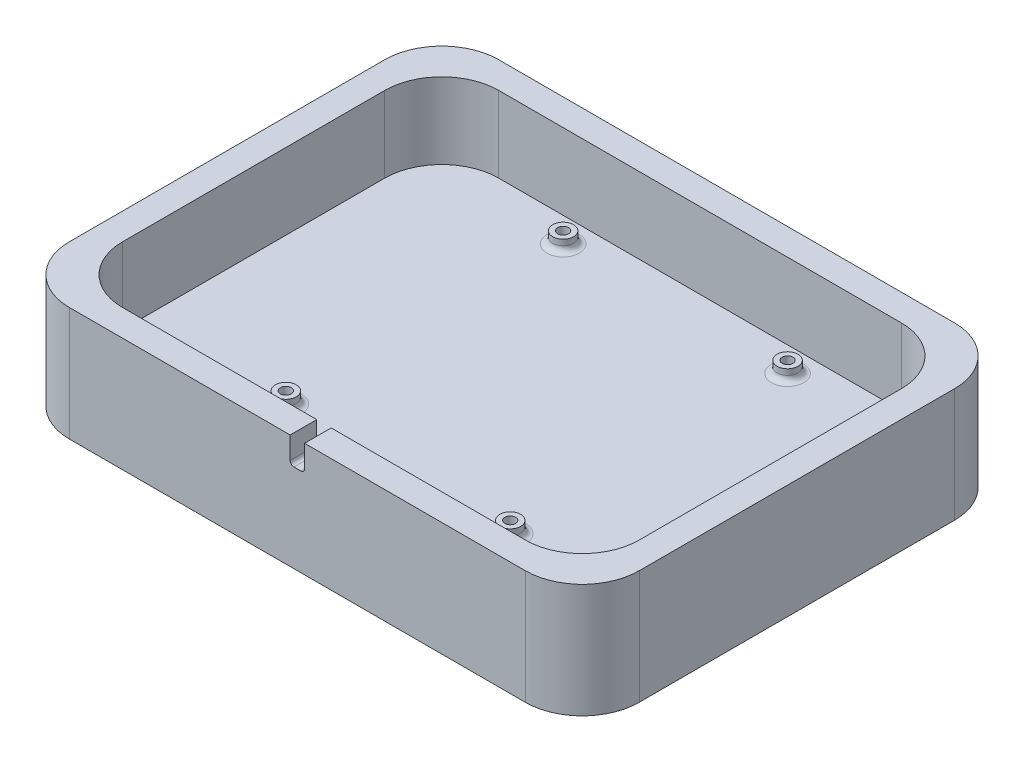
from build123d import *

# Parameters (mm, degrees)
SKETCH1_W                 = 150
SKETCH1_H                 = 100
BOSS_EXTRUDE1_DEPTH       = 10
SKETCH2_R                 = 2.75
BOSS_EXTRUDE2_DEPTH       = 3
F_1_0MM_DOWEL_HOLE1_D     = 2.85
F_1_0MM_DOWEL_HOLE1_DEPTH = 10
F_1_0MM_DOWEL_HOLE1_TIP   = 0.856226382
FILLET1_R                 = 1.5
SKETCH5_W                 = 150
SKETCH5_H                 = 13
BOSS_EXTRUDE3_DEPTH       = 10
SKETCH7_W                 = 150
SKETCH7_H                 = 113
SKETCH7_W_2               = 136
SKETCH7_H_2               = 99
EXTRUDE_THIN1_DEPTH       = 20
CUT_EXTRUDE1_REACH        = 140.903
FILLET2_R                 = 15
FILLET3_R                 = 15


with BuildPart() as part:
    # Sketch1 → Boss-Extrude1 (new body)
    with BuildSketch(Plane(origin=(0, 0, 0), x_dir=(1, 0, 0), z_dir=(0, 1, 0))):
        Rectangle(SKETCH1_W, SKETCH1_H)
    extrude(amount=BOSS_EXTRUDE1_DEPTH)

    # Sketch2 → Boss-Extrude2 (add)
    with BuildSketch(Plane(origin=(0, 10, 0), x_dir=(1, 0, 0), z_dir=(0, 1, 0))):
        with Locations((29.54, 36.5)):
            Circle(SKETCH2_R)
        with Locations((29.54, -36.5)):
            Circle(SKETCH2_R)
        with Locations((-29.54, -36.5)):
            Circle(SKETCH2_R)
        with Locations((-29.54, 36.5)):
            Circle(SKETCH2_R)
    extrude(amount=BOSS_EXTRUDE2_DEPTH)

    # Ø1.0mm Dowel Hole1
    with Locations(Plane(origin=(0, 13, 0), x_dir=(1, 0, 0), z_dir=(0, 1, 0))):
        with Locations((-29.54, 36.5), (29.54, 36.5), (29.54, -36.5), (-29.54, -36.5)):
            Hole(F_1_0MM_DOWEL_HOLE1_D / 2, depth=F_1_0MM_DOWEL_HOLE1_DEPTH)
            with Locations((0, 0, -(F_1_0MM_DOWEL_HOLE1_DEPTH + F_1_0MM_DOWEL_HOLE1_TIP / 2))):  # 118° drill point
                Cone(0, F_1_0MM_DOWEL_HOLE1_D / 2, F_1_0MM_DOWEL_HOLE1_TIP, mode=Mode.SUBTRACT)

    # Fillet1
    fillet1_edges = [part.edges().sort_by_distance(p)[0] for p in [
        (26.79, 10, 36.5),
        (-32.29, 10, 36.5),
        (26.79, 10, -36.5),
        (-32.29, 10, -36.5),
    ]]
    fillet(fillet1_edges, radius=FILLET1_R)

    # Sketch5 → Boss-Extrude3 (add)
    with BuildSketch(Plane.XZ):
        with Locations((0, 56.5)):
            Rectangle(SKETCH5_W, SKETCH5_H)
    extrude(amount=-BOSS_EXTRUDE3_DEPTH)

    # Sketch7 → Extrude-Thin1 (add)
    with BuildSketch(Plane(origin=(0, 10, 0), x_dir=(1, 0, 0), z_dir=(0, 1, 0))):
        with Locations((0, -6.5)):
            Rectangle(SKETCH7_W, SKETCH7_H)
        with Locations((0, -6.5)):
            Rectangle(SKETCH7_W_2, SKETCH7_H_2, mode=Mode.SUBTRACT)
    extrude(amount=EXTRUDE_THIN1_DEPTH)

    # Sketch8 → Cut-Extrude1 (cut, up to next)
    with BuildSketch(Plane.XY.offset(63), mode=Mode.PRIVATE) as cut_extrude1_sk1:
        with BuildLine():
            Line((-1.9, 30), (1.9, 30))
            Line((1.9, 30), (1.9, 24.2))
            ThreePointArc((1.9, 24.2), (1.607106781, 23.492893219), (0.9, 23.2))
            Line((0.9, 23.2), (-0.9, 23.2))
            ThreePointArc((-0.9, 23.2), (-1.607106781, 23.492893219), (-1.9, 24.2))
            Line((-1.9, 24.2), (-1.9, 30))
        make_face()
    cut_extrude1_tool1 = extrude(cut_extrude1_sk1.sketch, amount=-CUT_EXTRUDE1_REACH, mode=Mode.PRIVATE) & part.part
    add(cut_extrude1_tool1.solids().sort_by_distance((0, 26.653655, 63))[0], mode=Mode.SUBTRACT)

    # Fillet2
    fillet2_edges = [part.edges().sort_by_distance(p)[0] for p in [
        (75, 15, 63),
        (75, 15, -50),
        (-75, 15, -50),
        (-75, 15, 63),
    ]]
    fillet(fillet2_edges, radius=FILLET2_R)

    # Fillet3
    fillet3_edges = [part.edges().sort_by_distance(p)[0] for p in [
        (-68, 20, -43),
        (-68, 20, 56),
        (68, 20, -43),
        (68, 20, 56),
    ]]
    fillet(fillet3_edges, radius=FILLET3_R)


solid = part.part
